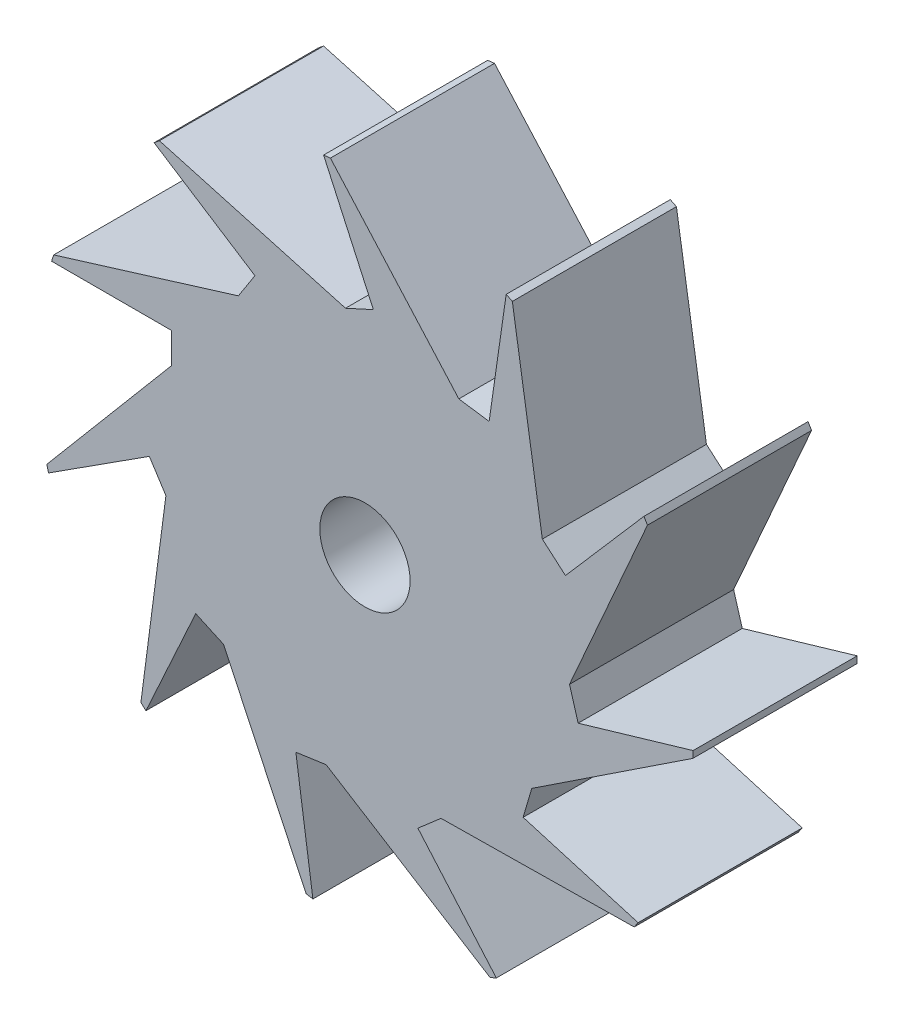
from build123d import *

# Parameters (mm, degrees)
SKETCH1_R           = 20
BOSS_EXTRUDE1_DEPTH = 10
CAVITY3_START       = 0.1
CAVITY3_DEPTH       = 9.9
CUT_EXTRUDE1_DEPTH  = 11
CIRPATTERN1_COUNT   = 11
SKETCH3_R           = 2.75
CUT_EXTRUDE2_DEPTH  = 11
SKETCH4_R           = 4.803689075
CUT_EXTRUDE3_DEPTH  = 6


# Read off the part's stored shape, not the designer's step: Cavity3
with BuildPart() as part:
    # Sketch1 → Boss-Extrude1 (new body)
    with BuildSketch(Plane.XY):
        Circle(SKETCH1_R)
    extrude(amount=BOSS_EXTRUDE1_DEPTH)

    # Cavity3 outline → Cavity3 (cut)
    with BuildSketch(Plane.XY.offset(CAVITY3_START)):
        with BuildLine():
            Line((-19.657828248, -3.683719394), (-12.793623997, 4.45))
            Line((-12.793623997, 4.45), (-12.793623997, 4.95))
            Line((-12.793623997, 4.95), (-19.377757868, 4.95))
            ThreePointArc((-19.377757868, 4.95), (-19.989485324, 0.648441592), (-19.657828248, -3.683719394))
        make_face()
    extrude(amount=CAVITY3_DEPTH, mode=Mode.SUBTRACT)

    # Sketch2 → Cut-Extrude1 (cut)
    with BuildSketch(Plane.XY.offset(10)):
        Polygon((-18.893600606, -4.32866599), (-20.741181365, -6.51795158), (-20.741181365, 5.95), (-19.377757868, 5.95), (-11.793623997, 5.95), (-11.793623997, 4.084431193), align=None)
    cut_extrude1 = extrude(amount=-CUT_EXTRUDE1_DEPTH, mode=Mode.SUBTRACT)

    # CirPattern1: Cut-Extrude1 ×11 about axis
    cirpattern1_axis = Axis((0, 0, 0), (0, 0, 1))
    for i in range(1, CIRPATTERN1_COUNT):
        add(cut_extrude1.rotate(cirpattern1_axis, i * 360 / CIRPATTERN1_COUNT), mode=Mode.SUBTRACT)

    # Sketch3 → Cut-Extrude2 (cut)
    with BuildSketch(Plane(origin=(0, 0, 0), x_dir=(-1, 0, 0), z_dir=(0, 0, -1))):
        Circle(SKETCH3_R)
    extrude(amount=-CUT_EXTRUDE2_DEPTH, mode=Mode.SUBTRACT)

    # Sketch4 → Cut-Extrude3 (cut)
    with BuildSketch(Plane(origin=(0, 0, 0), x_dir=(-1, 0, 0), z_dir=(0, 0, -1))):
        Circle(SKETCH4_R)
    extrude(amount=-CUT_EXTRUDE3_DEPTH, mode=Mode.SUBTRACT)


solid = part.part
